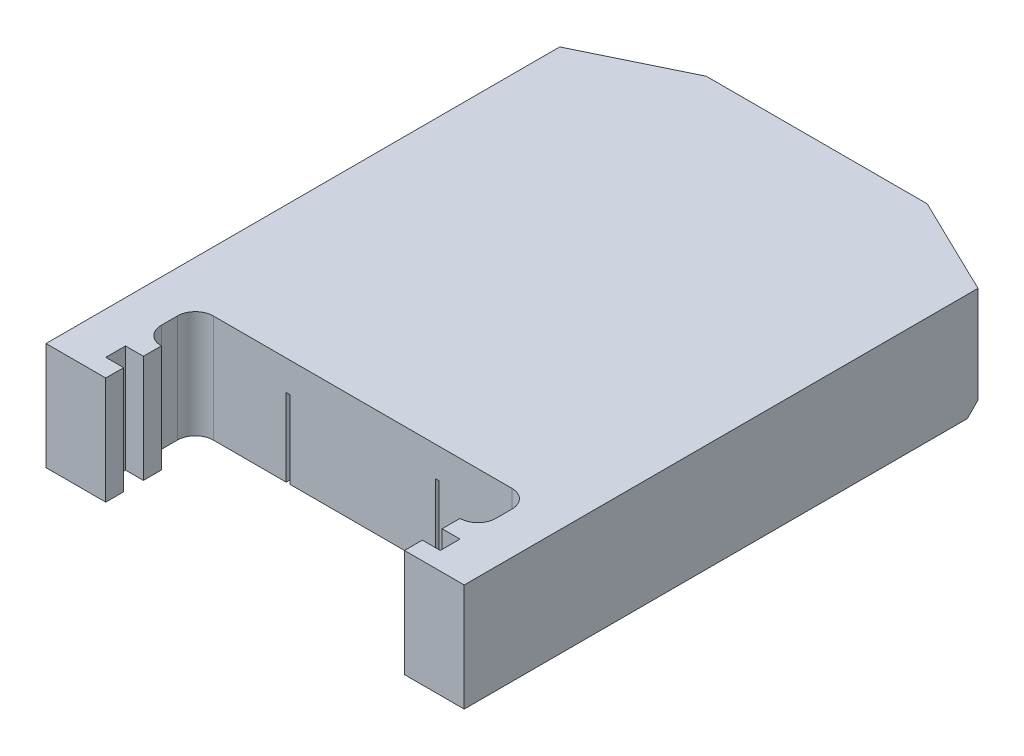
from build123d import *

# Parameters (mm, degrees)
SKETCH_1_W           = 70
SKETCH_1_H           = 18
EXTRUDE_1_DEPTH      = 60
CUT_EXTRUDE_1_DEPTH  = 94.936148527
SKETCH_3_W           = 15
SKETCH_3_H           = 5.3
CUT_EXTRUDE_2_DEPTH  = 1
SKETCH_4_W           = 15
SKETCH_4_H           = 5.3
CUT_EXTRUDE_3_DEPTH  = 1
SKETCH_5_W           = 3
SKETCH_5_H           = 11
CUT_EXTRUDE_4_DEPTH  = 1
SKETCH_6_W           = 3
SKETCH_6_H           = 11
CUT_EXTRUDE_5_DEPTH  = 1
CHAMFER_1_SIZE       = 1
EXTRUDE_9_DEPTH      = 6
SKETCH_7_W           = 29.5
SKETCH_7_H           = 9
CUT_EXTRUDE_7_DEPTH  = 4
SKETCH_9_W           = 37
SKETCH_9_H           = 7.5
EXTRUDE_3_DEPTH      = 12
SKETCH_10_W          = 70
SKETCH_10_H          = 18
EXTRUDE_4_DEPTH      = 8
CHAMFER_4_SIZE       = 4
SKETCH_11_W          = 8
SKETCH_11_H          = 11
CUT_EXTRUDE_8_DEPTH  = 3
SKETCH_12_W          = 0.6
SKETCH_12_H          = 33.5
CUT_EXTRUDE_9_DEPTH  = 13
SKETCH_13_W          = 0.6
SKETCH_13_H          = 52.5
EXTRUDE_5_DEPTH      = 6.7
SKETCH_14_W          = 0.6
SKETCH_14_H          = 10
EXTRUDE_6_DEPTH      = 1
SKETCH_15_W          = 7.7
SKETCH_15_H          = 49
EXTRUDE_7_DEPTH      = 0.6
SKETCH_18_W          = 7.7
SKETCH_18_H          = 10
EXTRUDE_8_DEPTH      = 0.6
CHAMFER_5_SIZE       = 1.8
SKETCH_22_W          = 3
SKETCH_22_H          = 6.5
CUT_EXTRUDE_10_DEPTH = 1
EXTRUDE_10_DEPTH     = 18
FILLET_1_R           = 3


with BuildPart() as part:
    # 草图1 → 凸台-拉伸1 (new body)
    with BuildSketch(Plane.XY):
        with Locations((35, 9)):
            Rectangle(SKETCH_1_W, SKETCH_1_H)
    extrude(amount=EXTRUDE_1_DEPTH)

    # 草图2 → 切除-拉伸1 (cut, through all)
    with BuildSketch(Plane.XY.offset(60)):
        Polygon((13.4, 0), (13.4, 5.3), (9.4, 5.3), (9.4, 12), (60.6, 12), (60.6, 5.3), (56.6, 5.3), (56.6, 0), align=None)
    extrude(amount=-CUT_EXTRUDE_1_DEPTH, mode=Mode.SUBTRACT)

    # 草图3 → 切除-拉伸2 (cut)
    with BuildSketch(Plane(origin=(13.4, 0, 0), x_dir=(0, 0, -1), z_dir=(1, 0, 0))):
        with Locations((-7.5, 2.65)):
            Rectangle(SKETCH_3_W, SKETCH_3_H)
    extrude(amount=-CUT_EXTRUDE_2_DEPTH, mode=Mode.SUBTRACT)

    # 草图4 → 切除-拉伸3 (cut)
    with BuildSketch(Plane.ZY.offset(-56.6)):
        with Locations((7.5, 2.65)):
            Rectangle(SKETCH_4_W, SKETCH_4_H)
    extrude(amount=-CUT_EXTRUDE_3_DEPTH, mode=Mode.SUBTRACT)

    # 草图5 → 切除-拉伸4 (cut)
    with BuildSketch(Plane(origin=(0, 5.3, 0), x_dir=(1, 0, 0), z_dir=(0, 1, 0))):
        with Locations((59.1, -5.5)):
            Rectangle(SKETCH_5_W, SKETCH_5_H)
    extrude(amount=-CUT_EXTRUDE_4_DEPTH, mode=Mode.SUBTRACT)

    # 草图6 → 切除-拉伸5 (cut)
    with BuildSketch(Plane(origin=(0, 5.3, 0), x_dir=(1, 0, 0), z_dir=(0, 1, 0))):
        with Locations((10.9, -5.5)):
            Rectangle(SKETCH_6_W, SKETCH_6_H)
    extrude(amount=-CUT_EXTRUDE_5_DEPTH, mode=Mode.SUBTRACT)

    # 倒角1
    chamfer_1_edges = [part.edges().sort_by_distance(p)[0] for p in [
        (59.1, 4.3, 11),
        (10.9, 4.3, 11),
        (12.4, 2.65, 15),
        (57.6, 2.65, 15),
    ]]
    chamfer(chamfer_1_edges, length=CHAMFER_1_SIZE - 0.0001)  # a hair under: the kernel refuses the full size

    # 草图21 → 凸台-拉伸9 (add)
    with BuildSketch(Plane(origin=(0, 18, 0), x_dir=(1, 0, 0), z_dir=(0, 1, 0))):
        Polygon((0, 0), (16.5, 8), (53.5, 8), (70, 0), align=None)
    extrude(amount=-EXTRUDE_9_DEPTH)

    # 草图7 → 切除-拉伸7 (cut)
    with BuildSketch(Plane.XZ.offset(-12)):
        with Locations((35, 0.5)):
            Rectangle(SKETCH_7_W, SKETCH_7_H)
    extrude(amount=-CUT_EXTRUDE_7_DEPTH, mode=Mode.SUBTRACT)

    # 草图9 → 凸台-拉伸3 (add)
    with BuildSketch(Plane.XZ.offset(-12)):
        with Locations((35, 56.25)):
            Rectangle(SKETCH_9_W, SKETCH_9_H)
    extrude(amount=EXTRUDE_3_DEPTH)

    # 草图10 → 凸台-拉伸4 (add)
    with BuildSketch(Plane.XY.offset(60)):
        with Locations((35, 9)):
            Rectangle(SKETCH_10_W, SKETCH_10_H)
    extrude(amount=EXTRUDE_4_DEPTH)

    # 倒角4
    chamfer_4_edges = [part.edges().sort_by_distance(p)[0] for p in [
        (35, 16, 5),
    ]]
    chamfer(chamfer_4_edges, length=CHAMFER_4_SIZE - 0.0001)  # a hair under: the kernel refuses the full size

    # 草图11 → 切除-拉伸8 (cut)
    with BuildSketch(Plane.XZ):
        with Locations((35, 58)):
            Rectangle(SKETCH_11_W, SKETCH_11_H)
    extrude(amount=-CUT_EXTRUDE_8_DEPTH, mode=Mode.SUBTRACT)

    # 草图12 → 切除-拉伸9 (cut)
    with BuildSketch(Plane.XZ):
        with Locations((22.5, 51.25)):
            Rectangle(SKETCH_12_W, SKETCH_12_H)
        with Locations((47.5, 51.25)):
            Rectangle(SKETCH_12_W, SKETCH_12_H)
    extrude(amount=-CUT_EXTRUDE_9_DEPTH, mode=Mode.SUBTRACT)

    # 草图13 → 凸台-拉伸5 (add)
    with BuildSketch(Plane.XZ.offset(-12)):
        with Locations((16.8, 26.25)):
            Rectangle(SKETCH_13_W, SKETCH_13_H)
        with Locations((53.2, 26.25)):
            Rectangle(SKETCH_13_W, SKETCH_13_H)
    extrude(amount=EXTRUDE_5_DEPTH)

    # 草图14 → 凸台-拉伸6 (add)
    with BuildSketch(Plane.XZ.offset(-5.3)):
        with Locations((16.8, 5)):
            Rectangle(SKETCH_14_W, SKETCH_14_H)
        with Locations((53.2, 5)):
            Rectangle(SKETCH_14_W, SKETCH_14_H)
    extrude(amount=EXTRUDE_6_DEPTH)

    # 草图15 → 凸台-拉伸7 (add)
    with BuildSketch(Plane.XZ.offset(-5.3)):
        with Locations((13.25, 35.5)):
            Rectangle(SKETCH_15_W, SKETCH_15_H)
        with Locations((56.75, 35.5)):
            Rectangle(SKETCH_15_W, SKETCH_15_H)
    extrude(amount=EXTRUDE_7_DEPTH)

    # 草图18 → 凸台-拉伸8 (add)
    with BuildSketch(Plane.XZ.offset(-4.3)):
        with Locations((13.25, 5)):
            Rectangle(SKETCH_18_W, SKETCH_18_H)
        with Locations((56.75, 5)):
            Rectangle(SKETCH_18_W, SKETCH_18_H)
    extrude(amount=EXTRUDE_8_DEPTH)

    # 倒角5
    chamfer_5_edges = [part.edges().sort_by_distance(p)[0] for p in [
        (35, 12, -8),
        (9.4, 12, 30),
        (60.6, 12, 30),
        (6.2, 0, 0),
        (63.8, 0, 0),
    ]]
    chamfer(chamfer_5_edges, length=CHAMFER_5_SIZE)

    # 草图22 → 切除-拉伸10 (cut)
    with BuildSketch(Plane.XZ):
        with Locations((24.3, 60.75)):
            Rectangle(SKETCH_22_W, SKETCH_22_H)
        with Locations((45.7, 60.75)):
            Rectangle(SKETCH_22_W, SKETCH_22_H)
    extrude(amount=-CUT_EXTRUDE_10_DEPTH, mode=Mode.SUBTRACT)

    # 草图23 → 凸台-拉伸10 (add)
    with BuildSketch(Plane(origin=(0, 18, 0), x_dir=(1, 0, 0), z_dir=(0, 1, 0))):
        Polygon((0, -68), (0, -86), (10, -86), (10, -83), (7, -83), (7, -79.7), (10, -79.7), (10, -76.7), (7, -76.7), (7, -68), align=None)
        Polygon((63, -68), (70, -68), (70, -86), (60, -86), (60, -83), (63, -83), (63, -79.7), (60, -79.7), (60, -76.7), (63, -76.7), align=None)
    extrude(amount=-EXTRUDE_10_DEPTH)

    # 圆角1
    fillet_1_edges = [part.edges().sort_by_distance(p)[0] for p in [
        (7, 9, 76.7),
        (7, 9, 68),
        (63, 9, 68),
        (63, 9, 76.7),
    ]]
    fillet(fillet_1_edges, radius=FILLET_1_R - 0.0001)  # a hair under: the kernel refuses the full size


solid = part.part
